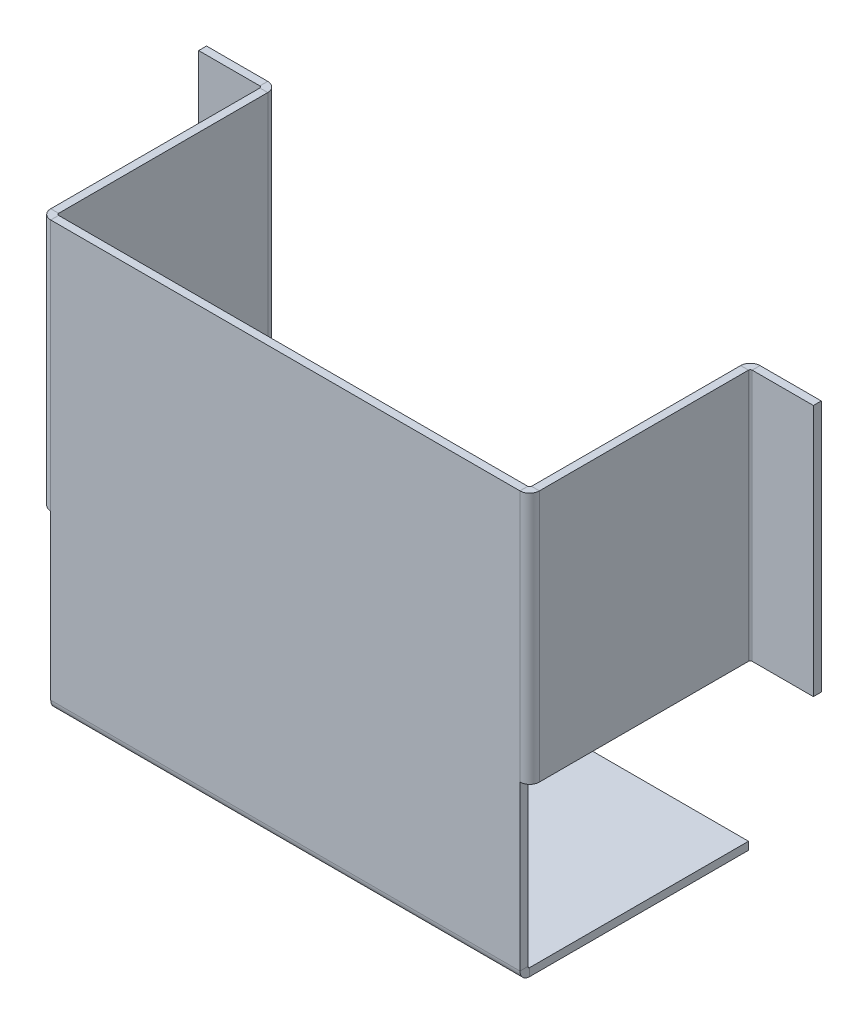
from build123d import *

# Parameters (mm, degrees)
BASE_FLANGE1_DEPTH = 101.6
EDGE_FLANGE1_START = -94.5134
EDGE_FLANGE1_DEPTH = 189.0268


# Read off the part's stored shape, not the designer's step: Edge-Flange1
# Sheet-metal steps are written as plain solids
with BuildPart() as part:
    # Sketch1 → Base-Flange1 (new body)
    with BuildSketch(Plane(origin=(0, 0, 0), x_dir=(1, 0, 0), z_dir=(0, 1, 0))):
        with BuildLine():
            Line((-123.825, 0), (-99.1616, 0))
            ThreePointArc((-99.1616, 0), (-96.395681115, -1.145681115), (-95.25, -3.9116))
            Line((-95.25, -3.9116), (-95.25, -88.1634))
            ThreePointArc((-95.25, -88.1634), (-95.034254855, -88.684254855), (-94.5134, -88.9))
            Line((-94.5134, -88.9), (94.5134, -88.9))
            ThreePointArc((94.5134, -88.9), (95.034254855, -88.684254855), (95.25, -88.1634))
            Line((95.25, -88.1634), (95.25, -3.9116))
            ThreePointArc((95.25, -3.9116), (96.395681115, -1.145681115), (99.1616, 0))
            Line((99.1616, 0), (123.825, 0))
            Line((123.825, 0), (123.825, -3.175))
            Line((123.825, -3.175), (99.1616, -3.175))
            ThreePointArc((99.1616, -3.175), (98.640745145, -3.390745145), (98.425, -3.9116))
            Line((98.425, -3.9116), (98.425, -88.1634))
            ThreePointArc((98.425, -88.1634), (97.279318885, -90.929318885), (94.5134, -92.075))
            Line((94.5134, -92.075), (-94.5134, -92.075))
            ThreePointArc((-94.5134, -92.075), (-97.279318885, -90.929318885), (-98.425, -88.1634))
            Line((-98.425, -88.1634), (-98.425, -3.9116))
            ThreePointArc((-98.425, -3.9116), (-98.640745145, -3.390745145), (-99.1616, -3.175))
            Line((-99.1616, -3.175), (-123.825, -3.175))
            Line((-123.825, -3.175), (-123.825, 0))
        make_face()
    extrude(amount=BASE_FLANGE1_DEPTH)

    # Edge-Flange1 outline → Edge-Flange1 (add)
    with BuildSketch(Plane.YZ.offset(EDGE_FLANGE1_START)):
        with BuildLine():
            Line((-69.85, 0), (-66.675, 0))
            Line((-66.675, 0), (-66.675, 88.1634))
            ThreePointArc((-66.675, 88.1634), (-66.459254855, 88.684254855), (-65.9384, 88.9))
            Line((-65.9384, 88.9), (0, 88.9))
            Line((0, 88.9), (0, 92.075))
            Line((0, 92.075), (-65.9384, 92.075))
            ThreePointArc((-65.9384, 92.075), (-68.704318885, 90.929318885), (-69.85, 88.1634))
            Line((-69.85, 88.1634), (-69.85, 0))
        make_face()
    extrude(amount=EDGE_FLANGE1_DEPTH)


solid = part.part
